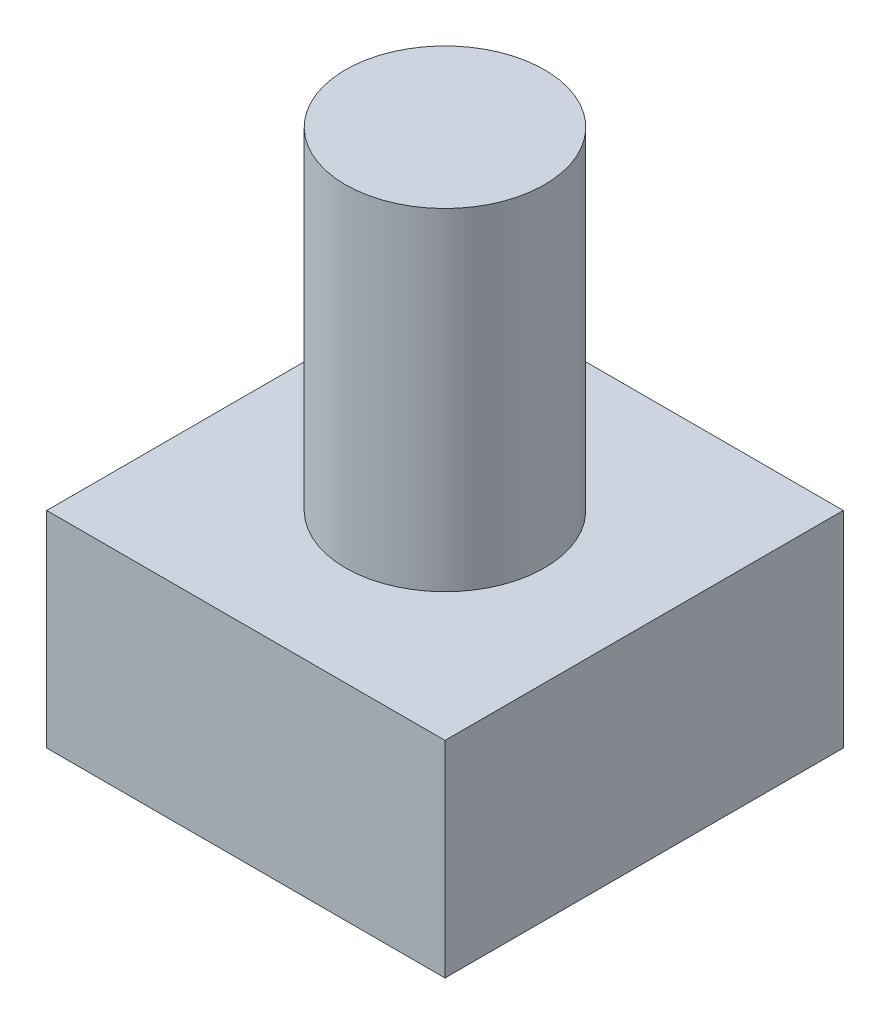
from build123d import *

# Parameters (mm, degrees)
SKETCH_1_W      = 6
SKETCH_1_H      = 6
EXTRUDE_1_DEPTH = 3.1
SKETCH_2_R      = 1.5
EXTRUDE_2_DEPTH = 5


with BuildPart() as part:
    # 草图1 → 拉伸1 (new body)
    with BuildSketch(Plane(origin=(0, 0, 0), x_dir=(1, 0, 0), z_dir=(0, 1, 0))):
        Rectangle(SKETCH_1_W, SKETCH_1_H)
    extrude(amount=EXTRUDE_1_DEPTH)

    # 草图2 → 拉伸2 (add)
    with BuildSketch(Plane(origin=(0, 3.1, 0), x_dir=(-1, 0, 0), z_dir=(0, 1, 0))):
        Circle(SKETCH_2_R)
    extrude(amount=EXTRUDE_2_DEPTH)


solid = part.part
